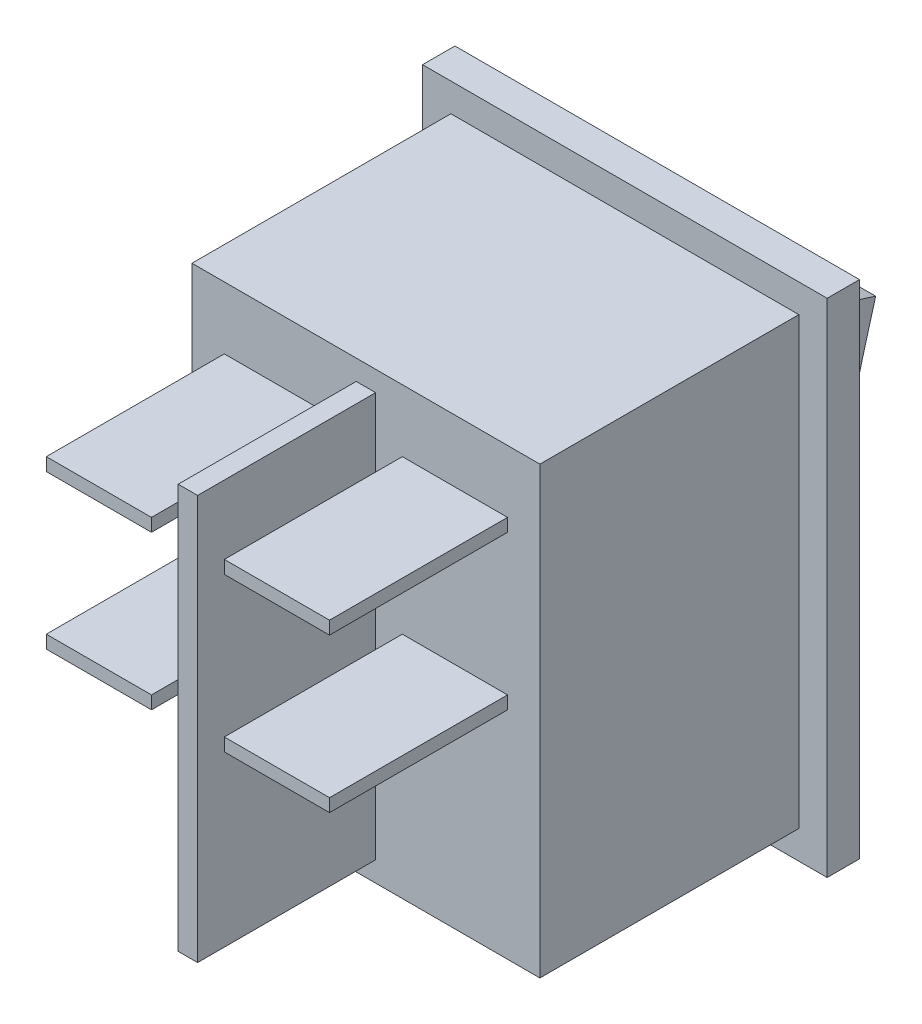
from build123d import *

# Parameters (mm, degrees)
SKETCH_1_W          = 25
SKETCH_1_H          = 31
EXTRUDE_1_DEPTH     = 2
SKETCH_2_W          = 21.5
SKETCH_2_H          = 27.5
EXTRUDE_2_DEPTH     = 27
SKETCH_3_W          = 19
SKETCH_3_H          = 24
EXTRUDE_3_DEPTH     = 4
CUT_EXTRUDE_START   = -19
CUT_EXTRUDE_1_DEPTH = 19
SKETCH_6_W          = 21.5
SKETCH_6_H          = 27.5
SKETCH_6_W_2        = 1.2
SKETCH_6_H_2        = 25
SKETCH_6_W_3        = 6.5
SKETCH_6_H_3        = 0.8
CUT_EXTRUDE_2_DEPTH = 11


# Read off the part's stored shape, not the designer's step: 切除-拉伸1
with BuildPart() as part:
    # 草图1 → 拉伸1 (new body)
    with BuildSketch(Plane.XY):
        Rectangle(SKETCH_1_W, SKETCH_1_H)
    extrude(amount=EXTRUDE_1_DEPTH)

    # 草图2 → 拉伸2 (add)
    with BuildSketch(Plane.XY.offset(2)):
        Rectangle(SKETCH_2_W, SKETCH_2_H)
    extrude(amount=EXTRUDE_2_DEPTH)

    # 草图3 → 拉伸3 (add)
    with BuildSketch(Plane(origin=(0, 0, 0), x_dir=(-1, 0, 0), z_dir=(0, 0, -1))):
        Rectangle(SKETCH_3_W, SKETCH_3_H)
    extrude(amount=EXTRUDE_3_DEPTH)

    # 切除-拉伸1 outline → 切除-拉伸1 (cut)
    with BuildSketch(Plane.ZY.offset(9.5).offset(CUT_EXTRUDE_START)):
        with BuildLine():
            Line((-4, -12), (-0.39560665, -12))
            add(Edge.make_bspline(
                [(-0.39560665, -12), (-0.407203251, -10.938807734), (-0.456034027, -6.470357075), (-1.244501589, 1.361302539), (-3.086230941, 7.87953286), (-4, 11.113535286)],
                knots=[0, 0, 0, 0, 0.135639857, 0.571150042, 1, 1, 1, 1], degree=3))
            Line((-4, 11.113535286), (-4, -12))
        make_face()
        with BuildLine():
            Line((-4, 12), (-4, 11.113535286))
            add(Edge.make_bspline(
                [(-4, 11.113535286), (-3.189353387, 11.383960845), (-1.884330596, 11.819306546), (-0.517710732, 11.950355346), (0, 12)],
                knots=[0, 0, 0, 0, 0.621174296, 1, 1, 1, 1], degree=3))
            Line((0, 12), (-4, 12))
        make_face()
    extrude(amount=CUT_EXTRUDE_1_DEPTH, mode=Mode.SUBTRACT)

    # 草图6 → 切除-拉伸2 (cut)
    with BuildSketch(Plane.XY.offset(29)):
        Rectangle(SKETCH_6_W, SKETCH_6_H)
        Rectangle(SKETCH_6_W_2, SKETCH_6_H_2, mode=Mode.SUBTRACT)
        with Locations((-5.5, 9.5)):
            Rectangle(SKETCH_6_W_3, SKETCH_6_H_3, mode=Mode.SUBTRACT)
        with Locations((5.5, 9.5)):
            Rectangle(SKETCH_6_W_3, SKETCH_6_H_3, mode=Mode.SUBTRACT)
        with Locations((-5.5, 0)):
            Rectangle(SKETCH_6_W_3, SKETCH_6_H_3, mode=Mode.SUBTRACT)
        with Locations((5.5, 0)):
            Rectangle(SKETCH_6_W_3, SKETCH_6_H_3, mode=Mode.SUBTRACT)
    extrude(amount=-CUT_EXTRUDE_2_DEPTH, mode=Mode.SUBTRACT)


solid = part.part
